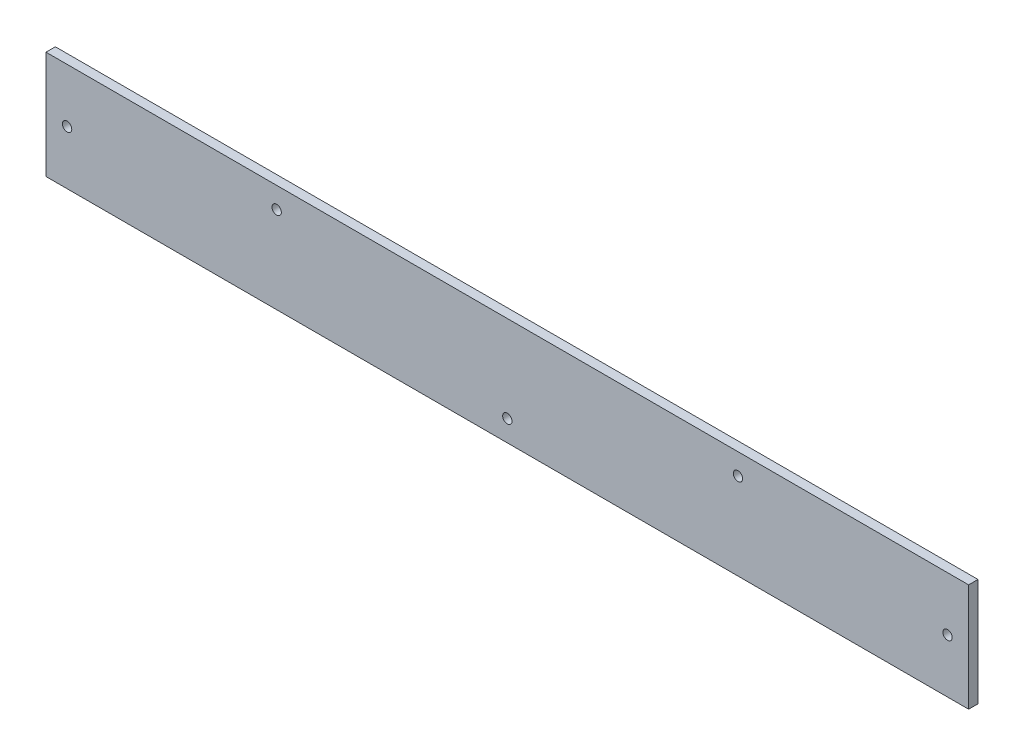
from build123d import *

# Parameters (mm, degrees)
SCHIZZO1_W                   = 394
SCHIZZO1_H                   = 46
SCHIZZO1_R                   = 2
ESTRUSIONE_ESTRUSIONE1_DEPTH = 4


with BuildPart() as part:
    # Schizzo1 → Estrusione-Estrusione1 (new body)
    with BuildSketch(Plane.XY):
        with Locations((197, 23)):
            Rectangle(SCHIZZO1_W, SCHIZZO1_H)
        with Locations((9, 23)):
            Circle(SCHIZZO1_R, mode=Mode.SUBTRACT)
        with Locations((98.5, 37)):
            Circle(SCHIZZO1_R, mode=Mode.SUBTRACT)
        with Locations((197, 9)):
            Circle(SCHIZZO1_R, mode=Mode.SUBTRACT)
        with Locations((385, 23)):
            Circle(SCHIZZO1_R, mode=Mode.SUBTRACT)
        with Locations((295.5, 37)):
            Circle(SCHIZZO1_R, mode=Mode.SUBTRACT)
    extrude(amount=ESTRUSIONE_ESTRUSIONE1_DEPTH)


solid = part.part
